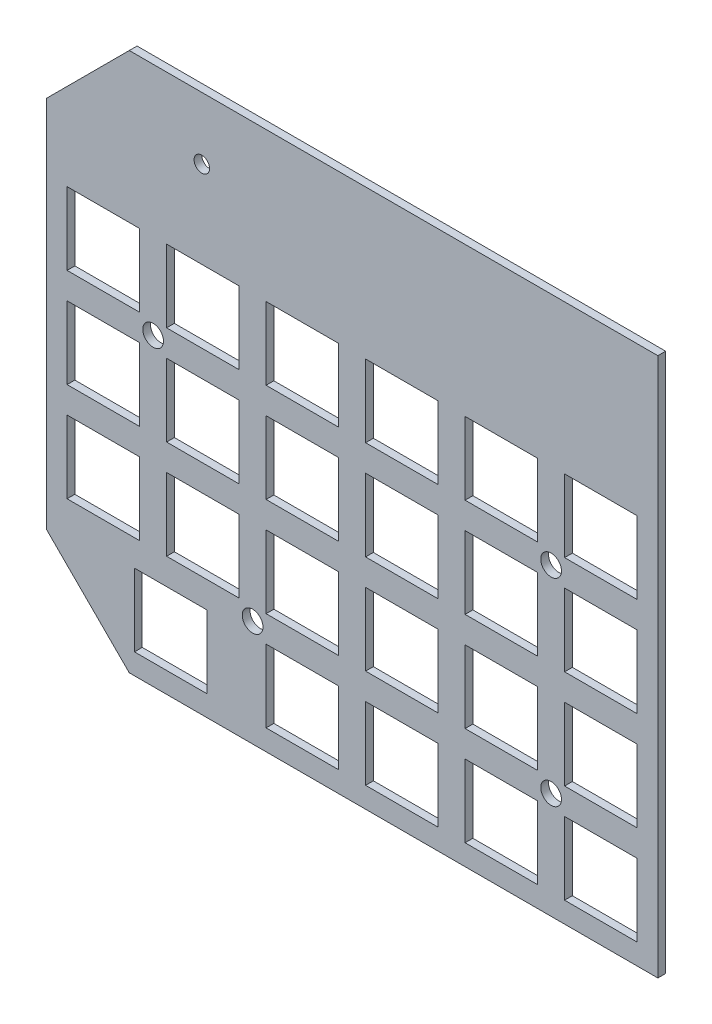
from build123d import *

# Parameters (mm, degrees)
BOSS_EXTRU_1_DEPTH      = 1.5
ESQUISSE2_R             = 2
ESQUISSE2_R_2           = 1.5
ESQUISSE2_W             = 14
ESQUISSE2_H             = 14
ENL_V_MAT_EXTRU_1_DEPTH = 1.5


with BuildPart() as part:
    # Esquisse1 → Boss.-Extru.1 (new body)
    with BuildSketch(Plane.XY):
        Polygon((0, -85), (16, -101), (118, -101), (118, 3), (16, 3), (0, -13), align=None)
    extrude(amount=BOSS_EXTRU_1_DEPTH)

    # Esquisse2 → Enlèv. mat.-Extru.1 (cut)
    with BuildSketch(Plane.XY.offset(1.5)):
        with Locations((20.6, -42.291142821)):
            Circle(ESQUISSE2_R)
        with Locations((97.4, -42.291142821)):
            Circle(ESQUISSE2_R)
        with Locations((97.4, -80.458228564)):
            Circle(ESQUISSE2_R)
        with Locations((39.8, -80.458228564)):
            Circle(ESQUISSE2_R)
        with Locations((30, -9)):
            Circle(ESQUISSE2_R_2)
        with Locations((11, -32.749371385)):
            Rectangle(ESQUISSE2_W, ESQUISSE2_H)
        with Locations((30.2, -32.749371385)):
            Rectangle(ESQUISSE2_W, ESQUISSE2_H)
        with Locations((49.4, -32.749371385)):
            Rectangle(ESQUISSE2_W, ESQUISSE2_H)
        with Locations((68.6, -32.749371385)):
            Rectangle(ESQUISSE2_W, ESQUISSE2_H)
        with Locations((87.8, -32.749371385)):
            Rectangle(ESQUISSE2_W, ESQUISSE2_H)
        with Locations((107, -32.749371385)):
            Rectangle(ESQUISSE2_W, ESQUISSE2_H)
        with Locations((30.2, -51.832914257)):
            Rectangle(ESQUISSE2_W, ESQUISSE2_H)
        with Locations((49.4, -51.832914257)):
            Rectangle(ESQUISSE2_W, ESQUISSE2_H)
        with Locations((68.6, -51.832914257)):
            Rectangle(ESQUISSE2_W, ESQUISSE2_H)
        with Locations((87.8, -51.832914257)):
            Rectangle(ESQUISSE2_W, ESQUISSE2_H)
        with Locations((107, -51.832914257)):
            Rectangle(ESQUISSE2_W, ESQUISSE2_H)
        with Locations((30.2, -70.916457128)):
            Rectangle(ESQUISSE2_W, ESQUISSE2_H)
        with Locations((49.4, -70.916457128)):
            Rectangle(ESQUISSE2_W, ESQUISSE2_H)
        with Locations((68.6, -70.916457128)):
            Rectangle(ESQUISSE2_W, ESQUISSE2_H)
        with Locations((87.8, -70.916457128)):
            Rectangle(ESQUISSE2_W, ESQUISSE2_H)
        with Locations((107, -70.916457128)):
            Rectangle(ESQUISSE2_W, ESQUISSE2_H)
        with Locations((11, -51.832914257)):
            Rectangle(ESQUISSE2_W, ESQUISSE2_H)
        with Locations((11, -70.916457128)):
            Rectangle(ESQUISSE2_W, ESQUISSE2_H)
        with Locations((49.4, -90)):
            Rectangle(ESQUISSE2_W, ESQUISSE2_H)
        with Locations((68.6, -90)):
            Rectangle(ESQUISSE2_W, ESQUISSE2_H)
        with Locations((87.8, -90)):
            Rectangle(ESQUISSE2_W, ESQUISSE2_H)
        with Locations((107, -90)):
            Rectangle(ESQUISSE2_W, ESQUISSE2_H)
        with Locations((24, -90)):
            Rectangle(ESQUISSE2_W, ESQUISSE2_H)
    extrude(amount=-ENL_V_MAT_EXTRU_1_DEPTH, mode=Mode.SUBTRACT)


solid = part.part
